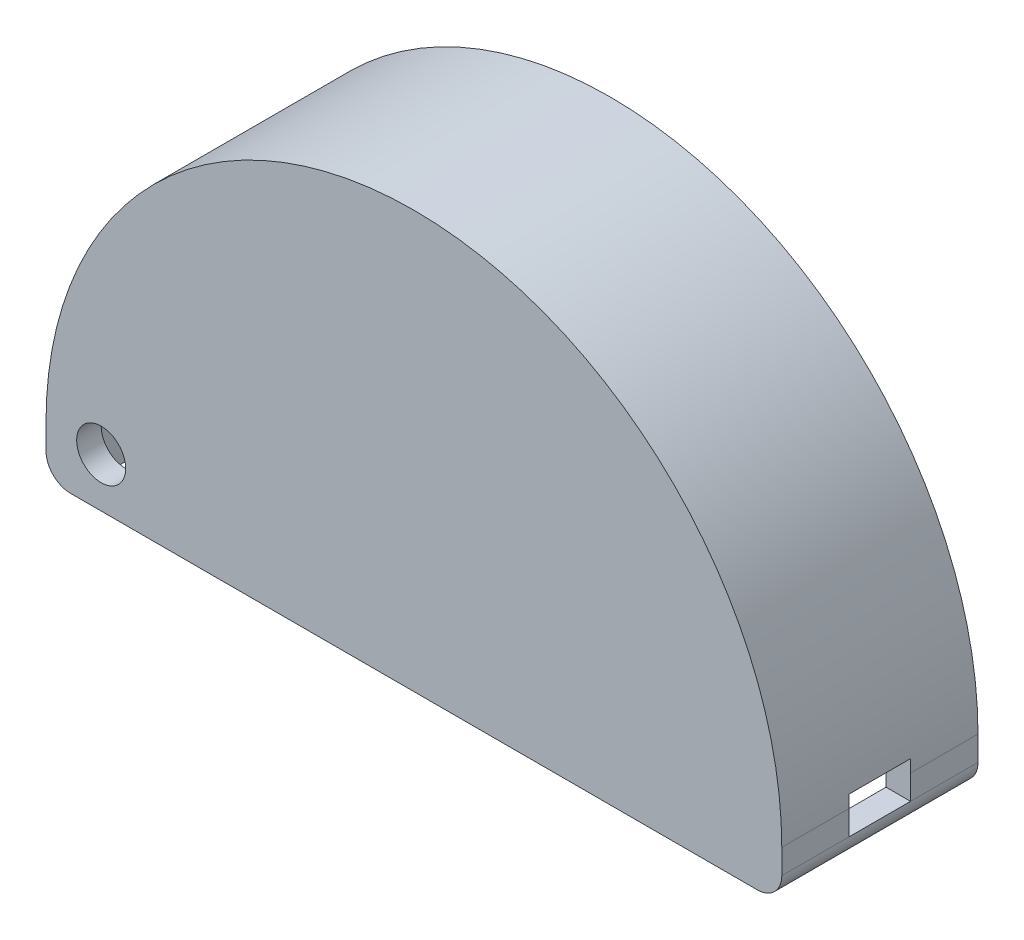
from build123d import *

# Parameters (mm, degrees)
BOSS_EXTRUDE1_DEPTH      = 4
BOSS_EXTRUDE1_DEPTH_BACK = 4
SHELL1_T                 = -1
CUT_EXTRUDE1_DEPTH       = 33.543240466
CUT_EXTRUDE1_DEPTH_BACK  = 33.543240466
SKETCH2_R                = 1
CUT_EXTRUDE2_REACH       = 35.779
CUT_EXTRUDE2_END_RADIUS  = 14
SKETCH3_W                = 2.5
SKETCH3_H                = 1.5
FILLET2_R                = 1


with BuildPart() as part:
    # Sketch1 → Boss-Extrude1 (new, two sides: drawn at the far end of the back side and taken through both)
    with BuildSketch(Plane.XY.offset(-BOSS_EXTRUDE1_DEPTH_BACK)):
        with BuildLine():
            Line((-2.25, -2), (27.75, -2))
            Line((27.75, -2), (27.75, 0))
            ThreePointArc((27.75, 0), (12.75, 15), (-2.25, 0))
            Line((-2.25, 0), (-2.25, -2))
        make_face()
    extrude(amount=BOSS_EXTRUDE1_DEPTH + BOSS_EXTRUDE1_DEPTH_BACK)

    # Shell1
    shell1_openings = [part.faces().sort_by_distance(p)[0] for p in [
        (12.75, -2, 0),
    ]]
    offset(amount=SHELL1_T, openings=shell1_openings, kind=Kind.INTERSECTION)

    # Sketch2 → Cut-Extrude1 (cut, two sides: drawn at the far end of the back side and taken through both)
    with BuildSketch(Plane.XY.offset(4).offset(-CUT_EXTRUDE1_DEPTH_BACK)):
        with Locations(Location((0, 0, 0), (0, 0, 180))):
            Circle(SKETCH2_R)
    extrude(amount=CUT_EXTRUDE1_DEPTH + CUT_EXTRUDE1_DEPTH_BACK, mode=Mode.SUBTRACT)

    # Cut-Extrude2: up to this cylinder (the profile starts outside it)
    cut_extrude2_end = Plane(origin=(12.75, 0, 0), z_dir=(0, 0, 1)) * Cylinder(CUT_EXTRUDE2_END_RADIUS, 100.558, mode=Mode.PRIVATE)
    # Sketch3 → Cut-Extrude2 (cut, up to the surface)
    with BuildSketch(Plane(origin=(27.75, 0, 0), x_dir=(0, 0, -1), z_dir=(1, 0, 0)), mode=Mode.PRIVATE) as cut_extrude2_sk1:
        with Locations((0, -0.25)):
            Rectangle(SKETCH3_W, SKETCH3_H)
    cut_extrude2_tool1 = extrude(cut_extrude2_sk1.sketch, amount=-CUT_EXTRUDE2_REACH, mode=Mode.PRIVATE) - cut_extrude2_end
    add(cut_extrude2_tool1.solids().sort_by_distance((27.75, -0.25, 0))[0], mode=Mode.SUBTRACT)

    # Fillet2
    fillet2_edges = [part.edges().sort_by_distance(p)[0] for p in [
        (27.75, -2, 0),
        (-2.25, -2, 0),
    ]]
    fillet(fillet2_edges, radius=FILLET2_R - 0.0001)  # a hair under: the kernel refuses the full size


solid = part.part
